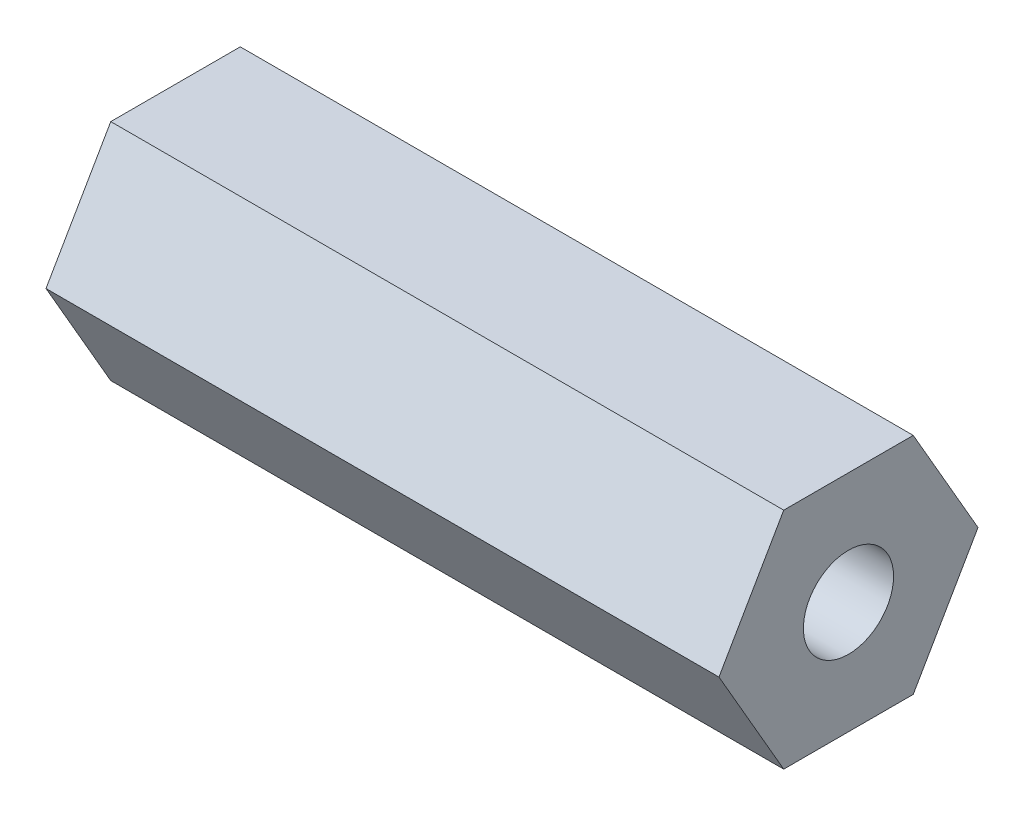
from build123d import *

# Parameters (mm, degrees)
BOSS_EXTRUDE1_DEPTH     = 19.05
F_1_4_20_TAPPED_HOLE1_D = 5.1054


with BuildPart() as part:
    # Sketch1 → Boss-Extrude1 (new, symmetric)
    with BuildSketch(Plane(origin=(0, 0, 0), x_dir=(0, 0, -1), z_dir=(1, 0, 0))):
        Polygon((7.332348419, 0), (3.666174209, 6.35), (-3.666174209, 6.35), (-7.332348419, 0), (-3.666174209, -6.35), (3.666174209, -6.35), align=None)
    extrude(amount=BOSS_EXTRUDE1_DEPTH, both=True)

    # 1/4-20 Tapped Hole1 (through all)
    with Locations(Plane(origin=(19.05, 0, 0), x_dir=(0, 0, -1), z_dir=(1, 0, 0))):
        with Locations((0, 0)):
            Hole(F_1_4_20_TAPPED_HOLE1_D / 2)


solid = part.part
